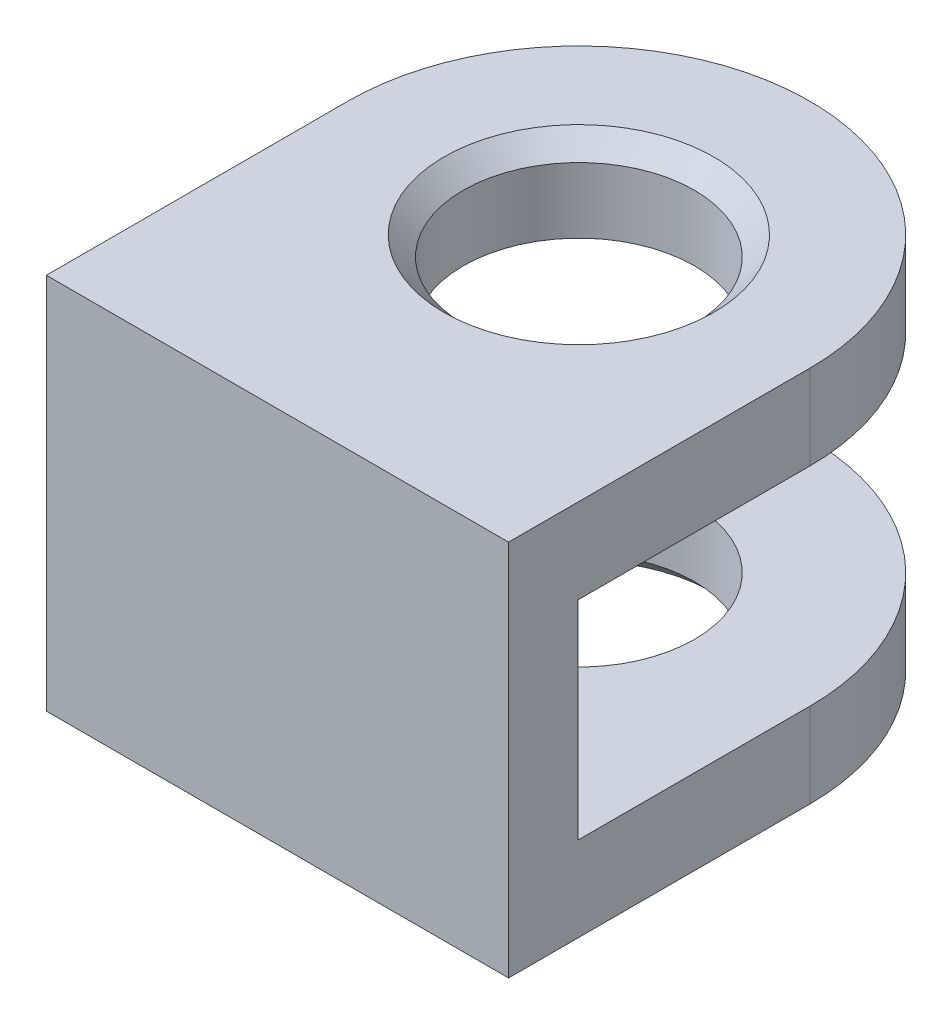
from build123d import *

# Parameters (mm, degrees)
SKETCH1_R           = 3
BOSS_EXTRUDE1_DEPTH = 4.9
CUT_EXTRUDE1_DEPTH  = 2.7
CHAMFER1_SIZE       = 0.5


with BuildPart() as part:
    # Sketch1 → Boss-Extrude1 (new, symmetric)
    with BuildSketch(Plane(origin=(0, 0, 0), x_dir=(1, 0, 0), z_dir=(0, 1, 0))):
        with BuildLine():
            Line((-6, 7.825), (-6, 0))
            Line((-6, 0), (6, 0))
            Line((6, 0), (6, 7.825))
            ThreePointArc((6, 7.825), (0, 13.825), (-6, 7.825))
        make_face()
        with Locations((0, 7.825)):
            Circle(SKETCH1_R, mode=Mode.SUBTRACT)
    extrude(amount=BOSS_EXTRUDE1_DEPTH, both=True)

    # Sketch3 → Cut-Extrude1 (cut, symmetric)
    with BuildSketch(Plane(origin=(0, 0, 0), x_dir=(1, 0, 0), z_dir=(0, 1, 0))):
        with BuildLine():
            Line((6, 1.8), (-6, 1.8))
            Line((-6, 1.8), (-6, 7.825))
            ThreePointArc((-6, 7.825), (0, 13.825), (6, 7.825))
            Line((6, 7.825), (6, 1.8))
        make_face()
    extrude(amount=CUT_EXTRUDE1_DEPTH, both=True, mode=Mode.SUBTRACT)

    # Chamfer1
    chamfer1_edges = [part.edges().sort_by_distance(p)[0] for p in [
        (-3, 4.9, -7.825),
        (-3, -4.9, -7.825),
    ]]
    chamfer(chamfer1_edges, length=CHAMFER1_SIZE)


solid = part.part
